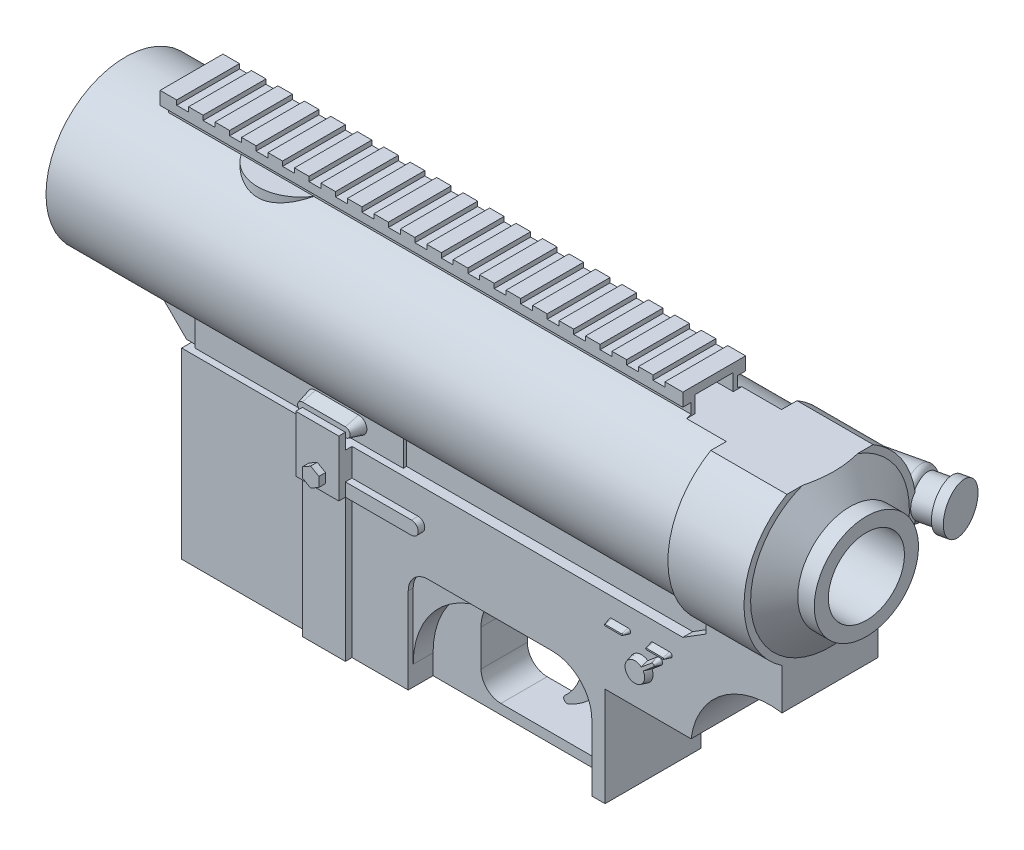
from build123d import *

# Parameters (mm, degrees)
EXTRUDE_START             = -46
EXTRUDE_1_DEPTH           = 158
EXTRUDE_2_DEPTH           = 14.5
CUT_EXTRUDE_1_DEPTH       = 1.5
CUT_EXTRUDE_3_DEPTH       = 6
CUT_EXTRUDE_4_DEPTH       = 242.40681432
EXTRUDE_3_DEPTH           = 2
EXTRUDE_START_2           = -11
SKETCH_8_R                = 26
EXTRUDE_4_DEPTH           = 23
CUT_EXTRUDE_5_DEPTH       = 3
SKETCH_10_W               = 13
SKETCH_10_H               = 55.3
EXTRUDE_5_DEPTH           = 2
SKETCH_11_W               = 63
SKETCH_11_H               = 84.5
EXTRUDE_6_DEPTH           = 1
EXTRUDE_7_DEPTH           = 2
EXTRUDE_7_DRAFT           = 15
EXTRUDE_8_DEPTH           = 2
EXTRUDE_8_DRAFT           = 15
EXTRUDE_8_PROFILE_2_DEPTH = 2
EXTRUDE_8_PROFILE_2_DRAFT = 15
EXTRUDE_9_DEPTH           = 4
EXTRUDE_9_TAPER           = 15
SKETCH_15_W               = 13
SKETCH_15_H               = 17
EXTRUDE_10_DEPTH          = 2
EXTRUDE_11_DEPTH          = 2
EXTRUDE_12_DEPTH          = 2
MIRROR_8_COPY_1_DEPTH     = 2
MIRROR_8_COPY_1_DRAFT     = 15
MIRROR_8_COPY_2_DEPTH     = 2
MIRROR_8_COPY_2_DRAFT     = 15
MIRROR_8_COPY_3_DEPTH     = 2
MIRROR_8_COPY_3_DRAFT     = 15
FILLET_2_R                = 2
CUT_EXTRUDE_6_REACH       = 256.545
CUT_EXTRUDE_6_END_RADIUS  = 21
SKETCH_20_W               = 58
SKETCH_20_H               = 21
SKETCH_21_W               = 139
SKETCH_21_H               = 15.5
CUT_EXTRUDE_7_DEPTH       = 51.5
CUT_EXTRUDE_START         = -2.5
SKETCH_22_W               = 32
SKETCH_22_H               = 11.5
CUT_EXTRUDE_8_DEPTH       = 5
SKETCH_24_W               = 26.057628442
SKETCH_24_H               = 7.5
CUT_EXTRUDE_10_DEPTH      = 46
SKETCH_25_W               = 3.6
SKETCH_25_H               = 1.4
CUT_EXTRUDE_11_DEPTH      = 245.235807084
PATTERN_LINEAR_1_COUNT    = 19
PATTERN_LINEAR_1_PITCH    = 8
EXTRUDE_START_3           = -9.825759099
EXTRUDE_13_DEPTH          = 2.825759099
CUT_EXTRUDE_12_REACH      = 259.045
CUT_EXTRUDE_12_END_RADIUS = 21
SKETCH_22_4_W             = 122
SKETCH_22_4_H             = 11.5


# Read off the part's stored shape, not the designer's step: 凸台-拉伸13
with BuildPart() as part:
    # 草图1 → 旋转1 (revolve)
    with BuildSketch(Plane.XY, mode=Mode.PRIVATE) as revolve_1_sk:
        Polygon((224, 0), (224, 15.75), (219, 15.75), (213, 24), (0, 24), (0, 0), align=None)
    revolve(revolve_1_sk.sketch.rotate(Axis((0, 0, 0), (1, 0, 0)), 90), axis=Axis((0, 0, 0), (1, 0, 0)))

    # 草图2 → 凸台-拉伸1 (add)
    with BuildSketch(Plane(origin=(224, 0, 0), x_dir=(0, 0, -1), z_dir=(1, 0, 0)).offset(EXTRUDE_START)):
        Polygon((7, 26.04), (9.5, 26.04), (9.5, 30), (-9.5, 30), (-9.5, 26.04), (-7, 26.04), (-7, 0), (7, 0), align=None)
    extrude(amount=-EXTRUDE_1_DEPTH)

    # 草图8 → 凸台-拉伸4 (add)
    with BuildSketch(Plane(origin=(224, 0, 0), x_dir=(0, 0, -1), z_dir=(1, 0, 0)).offset(EXTRUDE_START_2)):
        Circle(SKETCH_8_R)
    extrude(amount=-EXTRUDE_4_DEPTH)



with BuildPart() as body_2:
    # 草图3 → 凸台-拉伸2 (new, symmetric)
    with BuildSketch(Plane.XY):
        with BuildLine():
            Line((0, 0), (213, 0))
            Line((213, 0), (213, -24))
            Line((213, -24), (213, -34))
            ThreePointArc((213, -34), (194.940316698, -38.468717521), (185.5, -54.5))
            Line((185.5, -54.5), (159.5, -54.5))
            Line((159.5, -54.5), (159.5, -84.5))
            Line((159.5, -84.5), (31.5, -84.5))
            Line((31.5, -84.5), (31.5, -29.2))
            Line((31.5, -29.2), (30, -29.2))
            Line((30, -29.2), (24.8, -24))
            Line((24.8, -24), (0, 0))
        make_face()
    extrude(amount=EXTRUDE_2_DEPTH, both=True)

    # 草图4 → 切除-拉伸1 (cut, symmetric)
    with BuildSketch(Plane.XY.offset(14.5)):
        with BuildLine():
            Line((155.5, -84.5), (100, -84.5))
            Line((100, -84.5), (100, -58.5))
            ThreePointArc((100, -58.5), (101.757359313, -54.257359313), (106, -52.5))
            Line((106, -52.5), (143.5, -52.5))
            ThreePointArc((143.5, -52.5), (151.985281374, -56.014718626), (155.5, -64.5))
            Line((155.5, -64.5), (155.5, -84.5))
        make_face()
    cut_extrude_1 = extrude(amount=CUT_EXTRUDE_1_DEPTH, both=True, mode=Mode.SUBTRACT)

    # 草图5 → 切除-拉伸3 (cut)
    with BuildSketch(Plane.XY.offset(13)):
        with BuildLine():
            Line((100, -84.5), (100, -78.5))
            ThreePointArc((100, -78.5), (107.615223689, -60.115223689), (126, -52.5))
            Line((126, -52.5), (143.5, -52.5))
            ThreePointArc((143.5, -52.5), (151.985281374, -56.014718626), (155.5, -64.5))
            Line((155.5, -64.5), (155.5, -84.5))
            Line((155.5, -84.5), (100, -84.5))
        make_face()
    cut_extrude_3 = extrude(amount=-CUT_EXTRUDE_3_DEPTH, mode=Mode.SUBTRACT)

    # 镜向6: 切除-拉伸1, 切除-拉伸3 across plane
    add(cut_extrude_1.mirror(Plane.XY), mode=Mode.SUBTRACT)
    add(cut_extrude_3.mirror(Plane.XY), mode=Mode.SUBTRACT)

    # 草图6 → 切除-拉伸4 (cut, through all)
    with BuildSketch(Plane.XY.offset(7)):
        with BuildLine():
            Line((149.5, -81.5), (120.5, -81.5))
            ThreePointArc((120.5, -81.5), (116.257359313, -79.742640687), (114.5, -75.5))
            Line((114.5, -75.5), (114.5, -64.5))
            ThreePointArc((114.5, -64.5), (118.014718626, -56.014718626), (126.5, -52.5))
            Line((126.5, -52.5), (143.5, -52.5))
            ThreePointArc((143.5, -52.5), (151.985281374, -56.014718626), (155.5, -64.5))
            Line((155.5, -64.5), (155.5, -75.5))
            ThreePointArc((155.5, -75.5), (153.742640687, -79.742640687), (149.5, -81.5))
        make_face()
    extrude(amount=-CUT_EXTRUDE_4_DEPTH, mode=Mode.SUBTRACT)

    # 草图7 → 凸台-拉伸3 (add, symmetric)
    with BuildSketch(Plane.XY):
        with BuildLine():
            Line((143.5, -52.5), (137.5, -52.5))
            ThreePointArc((137.5, -52.5), (140.353606538, -64.129981713), (134.831914718, -74.75591529))
            ThreePointArc((134.831914718, -74.75591529), (134.654764231, -76.034393577), (135.885682736, -76.422631469))
            ThreePointArc((135.885682736, -76.422631469), (146.167441329, -67.202926144), (148.5, -53.591287885))
            ThreePointArc((148.5, -53.591287885), (146.058852734, -52.775995877), (143.5, -52.5))
        make_face()
    extrude(amount=EXTRUDE_3_DEPTH, both=True)

    # 草图9 → 切除-拉伸5 (cut)
    with BuildSketch(Plane.XY.offset(14.5)):
        Polygon((190, 0), (0, 0), (24.8, -24), (30, -29.2), (31.5, -29.2), (183, -29.2), (190, -24.825914537), align=None)
    cut_extrude_5 = extrude(amount=-CUT_EXTRUDE_5_DEPTH, mode=Mode.SUBTRACT)

    # 草图10 → 凸台-拉伸5 (add)
    with BuildSketch(Plane.XY.offset(14.5)):
        with Locations((76.5, -56.85)):
            Rectangle(SKETCH_10_W, SKETCH_10_H)
    extrude_5 = extrude(amount=EXTRUDE_5_DEPTH)

    # 草图11 → 凸台-拉伸6 (add)
    with BuildSketch(Plane.XY.offset(11.5)):
        with Locations((65, -42.25)):
            Rectangle(SKETCH_11_W, SKETCH_11_H)
    extrude_6 = extrude(amount=EXTRUDE_6_DEPTH)

    # 镜向7: 切除-拉伸5 across plane
    add(cut_extrude_5.mirror(Plane.XY), mode=Mode.SUBTRACT)

    # Mirror 7 2: 凸台-拉伸5, 凸台-拉伸6 across plane
    add(extrude_5.mirror(Plane.XY))
    add(extrude_6.mirror(Plane.XY))


with BuildPart() as extrude_7_tool:
    # 草图12 → 凸台-拉伸7 (with draft: the straight prism first)
    with BuildSketch(Plane.XY.offset(14.5)):
        with BuildLine():
            ThreePointArc((172.426603563, -40.577980371), (167.818844449, -45.749756634), (173.712178783, -42.110069258))
            Line((173.712178783, -42.110069258), (176.505678776, -39.766044443))
            ThreePointArc((176.505678776, -39.766044443), (176.62893561, -38.35721239), (175.220103557, -38.233955557))
            Line((175.220103557, -38.233955557), (172.426603563, -40.577980371))
        make_face()
    extrude(amount=EXTRUDE_7_DEPTH)
    # 凸台-拉伸7: the draft: its side faces are tilted about the plane it starts from
    extrude_7_sides = [extrude_7_tool.faces().sort_by_distance(p)[0] for p in [
        (167.818844449, -45.749756634, 15.5),
        (175.108928779, -40.93805685, 15.5),
        (176.62893561, -38.35721239, 15.5),
        (173.82335356, -39.405967964, 15.5),
    ]]
    draft(extrude_7_sides, Plane.XY.offset(14.5), EXTRUDE_7_DRAFT)


with BuildPart() as body_2_1:
    add(body_2.part)

    # 凸台-拉伸7: add extrude_7_tool
    add(extrude_7_tool.part)


with BuildPart() as extrude_8_tool:
    # 草图13 → 凸台-拉伸8 (with draft: the straight prism first)
    with BuildSketch(Plane.XY.offset(14.5)):
        with BuildLine():
            ThreePointArc((161.5, -35), (160.75, -35.75), (161.5, -36.5))
            Line((161.5, -36.5), (166.5, -36.5))
            ThreePointArc((166.5, -36.5), (167.25, -35.75), (166.5, -35))
            Line((166.5, -35), (161.5, -35))
        make_face()
    extrude(amount=EXTRUDE_8_DEPTH)
    # 凸台-拉伸8: the draft: its side faces are tilted about the plane it starts from
    extrude_8_sides = [extrude_8_tool.faces().sort_by_distance(p)[0] for p in [
        (160.75, -35.75, 15.5),
        (164, -36.5, 15.5),
        (167.25, -35.75, 15.5),
        (164, -35, 15.5),
    ]]
    draft(extrude_8_sides, Plane.XY.offset(14.5), EXTRUDE_8_DRAFT)


with BuildPart() as body_2_2:
    add(body_2_1.part)

    # 凸台-拉伸8: add extrude_8_tool
    add(extrude_8_tool.part)


with BuildPart() as extrude_8_profile_2_tool:
    # 草图13 → 凸台-拉伸8 profile 2 (with draft: the straight prism first)
    with BuildSketch(Plane.XY.offset(14.5)):
        with BuildLine():
            ThreePointArc((174, -35), (173.25, -35.75), (174, -36.5))
            Line((174, -36.5), (179, -36.5))
            ThreePointArc((179, -36.5), (179.75, -35.75), (179, -35))
            Line((179, -35), (174, -35))
        make_face()
    extrude(amount=EXTRUDE_8_PROFILE_2_DEPTH)
    # 凸台-拉伸8 profile 2: the draft: its side faces are tilted about the plane it starts from
    extrude_8_profile_2_sides = [extrude_8_profile_2_tool.faces().sort_by_distance(p)[0] for p in [
        (173.25, -35.75, 15.5),
        (176.5, -36.5, 15.5),
        (179.75, -35.75, 15.5),
        (176.5, -35, 15.5),
    ]]
    draft(extrude_8_profile_2_sides, Plane.XY.offset(14.5), EXTRUDE_8_PROFILE_2_DRAFT)


with BuildPart() as body_2_3:
    add(body_2_2.part)

    # 凸台-拉伸8 profile 2: add extrude_8_profile_2_tool
    add(extrude_8_profile_2_tool.part)


with BuildPart() as part_1:
    add(part.part)

    add(body_2_3.part)  # 凸台-拉伸9 merges body 2
    # 草图14 → 凸台-拉伸9 (add)
    with BuildSketch(Plane.XY.offset(12.5)):
        with BuildLine():
            ThreePointArc((70, -22), (67.5, -24.5), (70, -27))
            Line((70, -27), (83, -27))
            ThreePointArc((83, -27), (85.5, -24.5), (83, -22))
            Line((83, -22), (70, -22))
        make_face()
    extrude_9 = extrude(amount=EXTRUDE_9_DEPTH, taper=EXTRUDE_9_TAPER)

    # 草图15 → 凸台-拉伸10 (add)
    with BuildSketch(Plane.XY.offset(16.5)):
        with Locations((76.5, -33)):
            Rectangle(SKETCH_15_W, SKETCH_15_H)
    extrude(amount=EXTRUDE_10_DEPTH)

    # 草图16 → 凸台-拉伸11 (add)
    with BuildSketch(Plane.XY.offset(14.5)):
        with BuildLine():
            Line((83, -37.5), (103, -37.5))
            ThreePointArc((103, -37.5), (105, -39.5), (103, -41.5))
            Line((103, -41.5), (83, -41.5))
            ThreePointArc((83, -41.5), (81, -39.5), (83, -37.5))
        make_face()
    extrude(amount=EXTRUDE_11_DEPTH)

    # 草图17 → 凸台-拉伸12 (add)
    with BuildSketch(Plane.XY.offset(18.5)):
        Polygon((79, -36.056624327), (76.5, -34.613248654), (74, -36.056624327), (74, -38.943375673), (76.5, -40.386751346), (79, -38.943375673), align=None)
    extrude(amount=EXTRUDE_12_DEPTH)

    # 镜向8: 凸台-拉伸9 across plane
    add(extrude_9.mirror(Plane.XY))


with BuildPart() as mirror_8_copy_1_tool:
    # 镜向8 copy 1 sketch → 镜向8 copy 1 (with draft: the straight prism first)
    with BuildSketch(Plane(origin=(0, 0, -14.5), x_dir=(1, 0, 0), z_dir=(0, 0, -1))):
        with BuildLine():
            ThreePointArc((161.5, 35), (160.75, 35.75), (161.5, 36.5))
            Line((161.5, 36.5), (166.5, 36.5))
            ThreePointArc((166.5, 36.5), (167.25, 35.75), (166.5, 35))
            Line((166.5, 35), (161.5, 35))
        make_face()
    extrude(amount=MIRROR_8_COPY_1_DEPTH)
    # 镜向8 copy 1: the draft: its side faces are tilted about the plane it starts from
    mirror_8_copy_1_sides = [mirror_8_copy_1_tool.faces().sort_by_distance(p)[0] for p in [
        (160.75, -35.75, -15.5),
        (164, -36.5, -15.5),
        (167.25, -35.75, -15.5),
        (164, -35, -15.5),
    ]]
    draft(mirror_8_copy_1_sides, Plane(origin=(0, 0, -14.5), x_dir=(1, 0, 0), z_dir=(0, 0, -1)), MIRROR_8_COPY_1_DRAFT)


with BuildPart() as part_2:
    add(part_1.part)

    # 镜向8 copy 1: add mirror_8_copy_1_tool
    add(mirror_8_copy_1_tool.part)


with BuildPart() as mirror_8_copy_2_tool:
    # 镜向8 copy 2 sketch → 镜向8 copy 2 (with draft: the straight prism first)
    with BuildSketch(Plane(origin=(0, 0, -14.5), x_dir=(1, 0, 0), z_dir=(0, 0, -1))):
        with BuildLine():
            ThreePointArc((174, 35), (173.25, 35.75), (174, 36.5))
            Line((174, 36.5), (179, 36.5))
            ThreePointArc((179, 36.5), (179.75, 35.75), (179, 35))
            Line((179, 35), (174, 35))
        make_face()
    extrude(amount=MIRROR_8_COPY_2_DEPTH)
    # 镜向8 copy 2: the draft: its side faces are tilted about the plane it starts from
    mirror_8_copy_2_sides = [mirror_8_copy_2_tool.faces().sort_by_distance(p)[0] for p in [
        (173.25, -35.75, -15.5),
        (176.5, -36.5, -15.5),
        (179.75, -35.75, -15.5),
        (176.5, -35, -15.5),
    ]]
    draft(mirror_8_copy_2_sides, Plane(origin=(0, 0, -14.5), x_dir=(1, 0, 0), z_dir=(0, 0, -1)), MIRROR_8_COPY_2_DRAFT)


with BuildPart() as part_3:
    add(part_2.part)

    # 镜向8 copy 2: add mirror_8_copy_2_tool
    add(mirror_8_copy_2_tool.part)


with BuildPart() as mirror_8_copy_3_tool:
    # 镜向8 copy 3 sketch → 镜向8 copy 3 (with draft: the straight prism first)
    with BuildSketch(Plane(origin=(0, 0, -14.5), x_dir=(1, 0, 0), z_dir=(0, 0, -1))):
        with BuildLine():
            ThreePointArc((174, 35), (173.25, 35.75), (174, 36.5))
            Line((174, 36.5), (179, 36.5))
            ThreePointArc((179, 36.5), (179.75, 35.75), (179, 35))
            Line((179, 35), (174, 35))
        make_face()
    extrude(amount=MIRROR_8_COPY_3_DEPTH)
    # 镜向8 copy 3: the draft: its side faces are tilted about the plane it starts from
    mirror_8_copy_3_sides = [mirror_8_copy_3_tool.faces().sort_by_distance(p)[0] for p in [
        (173.25, -35.75, -15.5),
        (176.5, -36.5, -15.5),
        (179.75, -35.75, -15.5),
        (176.5, -35, -15.5),
    ]]
    draft(mirror_8_copy_3_sides, Plane(origin=(0, 0, -14.5), x_dir=(1, 0, 0), z_dir=(0, 0, -1)), MIRROR_8_COPY_3_DRAFT)


with BuildPart() as part_4:
    add(part_3.part)

    # 镜向8 copy 3: add mirror_8_copy_3_tool
    add(mirror_8_copy_3_tool.part)


with BuildPart() as body_2_2_1:
    # 草图18 → 旋转2 (revolve)
    with BuildSketch(Plane(origin=(0, 0, 0), x_dir=(1, 0, 0), z_dir=(0, 1, 0)), mode=Mode.PRIVATE) as revolve_2_sk:
        Polygon((220.5, 32), (218.92534262, 38.820590453), (216.002232425, 38.14573729), (216.283421243, 36.927774709), (210.437200854, 35.578068383), (210.156012037, 36.796030964), (80.318114643, 6.820590453), (81.892772023, 0), align=None)
    revolve(revolve_2_sk.sketch.rotate(Axis((81.892772023, 0, 0), (0.9743700647852352, 0, -0.22495105434386534)), 180), axis=Axis((81.892772023, 0, 0), (0.9743700647852352, 0, -0.22495105434386534)))

    # 圆角2
    # the kernel refuses this fillet: 2 mm, written as the material it takes off along each edge
    with BuildSketch(Plane(origin=(211.730669417, 0, -29.975440511), x_dir=(0.2249510543438665, 0, 0.9743700647852349), z_dir=(0, 1, 0))) as fillet_2_piece_1:
        with BuildLine():
            CenterArc((5, -1.854049622), FILLET_2_R, 360, 67.975687163)
            Line((7, -1.854049622), (7.04, -1.854049622))
            Line((7.04, -1.854049622), (7.04, 0))
            Line((7.04, 0), (7, 0.04))
            ThreePointArc((7, 0.04), (6.375, 0.04), (5.765, 0.037080992))
            Line((5.765, 0.037080992), (5.75, 0))
        make_face()
    revolve(axis=Axis((211.730669417, 0, -29.975440511), (0.9743700647852352, 0, -0.22495105434386534)), mode=Mode.SUBTRACT)


with BuildPart() as cut_revolve_1_tool:
    # 草图19 → 切除-旋转1 (revolve)
    with BuildSketch(Plane.XY):
        Polygon((224, 0), (224, -11.5), (201, -11.5), (201, -21), (0, -21), (0, 0), align=None)
    revolve(axis=Axis((0, 0, 0), (1, 0, 0)))


with BuildPart() as part_5:
    add(part_4.part)

    # 切除-旋转1: cut by cut_revolve_1_tool
    add(cut_revolve_1_tool.part, mode=Mode.SUBTRACT)


with BuildPart() as body_2_2_2:
    add(body_2_2_1.part)

    # 切除-旋转1: cut by cut_revolve_1_tool
    add(cut_revolve_1_tool.part, mode=Mode.SUBTRACT)


with BuildPart() as part_6:
    add(part_5.part)

    # Combine 1: union body 2 2
    add(body_2_2_2.part)

    # 切除-拉伸6: up to this cylinder (the profile starts outside it)
    cut_extrude_6_end = Plane(origin=(67.5, 0, 0), z_dir=(-1, 0, 0)) * Cylinder(CUT_EXTRUDE_6_END_RADIUS, 556.09, mode=Mode.PRIVATE)
    # 草图20 → 切除-拉伸6 (cut, up to the surface)
    with BuildSketch(Plane.XZ.offset(84.5), mode=Mode.PRIVATE) as cut_extrude_6_sk1:
        with Locations((67.5, 0)):
            Rectangle(SKETCH_20_W, SKETCH_20_H)
    cut_extrude_6_tool1 = extrude(cut_extrude_6_sk1.sketch, amount=-CUT_EXTRUDE_6_REACH, mode=Mode.PRIVATE) - cut_extrude_6_end
    add(cut_extrude_6_tool1.solids().sort_by_distance((67.5, -84.5, 0))[0], mode=Mode.SUBTRACT)

    # 草图21 → 切除-拉伸7 (cut)
    with BuildSketch(Plane(origin=(0, 0, 0), x_dir=(1, 0, 0), z_dir=(0, 1, 0))):
        with Locations((108, 0)):
            Rectangle(SKETCH_21_W, SKETCH_21_H)
    extrude(amount=-CUT_EXTRUDE_7_DEPTH, mode=Mode.SUBTRACT)

    # 草图22 → 切除-拉伸8 (cut)
    with BuildSketch(Plane(origin=(0, 30, 0), x_dir=(1, 0, 0), z_dir=(0, 1, 0)).offset(CUT_EXTRUDE_START)):
        with Locations((162, 0)):
            Rectangle(SKETCH_22_W, SKETCH_22_H)
    extrude(amount=-CUT_EXTRUDE_8_DEPTH, mode=Mode.SUBTRACT)

    # 草图24 → 切除-拉伸10 (cut)
    with BuildSketch(Plane(origin=(224, 0, 0), x_dir=(0, 0, -1), z_dir=(1, 0, 0))):
        with Locations((0, 26.25)):
            Rectangle(SKETCH_24_W, SKETCH_24_H)
    extrude(amount=-CUT_EXTRUDE_10_DEPTH, mode=Mode.SUBTRACT)

    # 草图25 → 切除-拉伸11 (cut, through all)
    with BuildSketch(Plane.XY.offset(9.5)):
        with Locations((26.8, 29.3)):
            Rectangle(SKETCH_25_W, SKETCH_25_H)
    cut_extrude_11 = extrude(amount=-CUT_EXTRUDE_11_DEPTH, mode=Mode.SUBTRACT)

    # 阵列(线性)1: 切除-拉伸11 ×19
    with Locations(*[(i * PATTERN_LINEAR_1_PITCH, 0, 0) for i in range(1, PATTERN_LINEAR_1_COUNT)]):
        add(cut_extrude_11, mode=Mode.SUBTRACT)

    # 凸台-拉伸13 outline → 凸台-拉伸13 (add)
    with BuildSketch(Plane(origin=(0, 30, 0), x_dir=(1, 0, 0), z_dir=(0, 1, 0)).offset(EXTRUDE_START_3)):
        with BuildLine():
            Line((63.954451176, -6.999999959), (42.045548775, -6.999999882))
            ThreePointArc((42.045548775, -6.999999882), (52.999999954, -13), (63.954451176, -6.999999959))
        make_face()
        with BuildLine():
            Line((42.045548842, 6.999999987), (63.954451159, 6.999999986))
            ThreePointArc((63.954451159, 6.999999986), (53.000000001, 13), (42.045548842, 6.999999987))
        make_face()
    extrude(amount=EXTRUDE_13_DEPTH)

    # 切除-拉伸12: up to this cylinder (the profile starts outside it)
    cut_extrude_12_end = Plane(origin=(85, 0, 0), z_dir=(-1, 0, 0)) * Cylinder(CUT_EXTRUDE_12_END_RADIUS, 561.09, mode=Mode.PRIVATE)
    # 草图22<4> → 切除-拉伸12 (cut, up to the surface)
    with BuildSketch(Plane(origin=(0, 30, 0), x_dir=(1, 0, 0), z_dir=(0, 1, 0)).offset(CUT_EXTRUDE_START), mode=Mode.PRIVATE) as cut_extrude_12_sk1:
        with Locations((85, 0)):
            Rectangle(SKETCH_22_4_W, SKETCH_22_4_H)
    cut_extrude_12_tool1 = extrude(cut_extrude_12_sk1.sketch, amount=-CUT_EXTRUDE_12_REACH, mode=Mode.PRIVATE) - cut_extrude_12_end
    add(cut_extrude_12_tool1.solids().sort_by_distance((85, 27.5, 0))[0], mode=Mode.SUBTRACT)


solid = part_6.part
